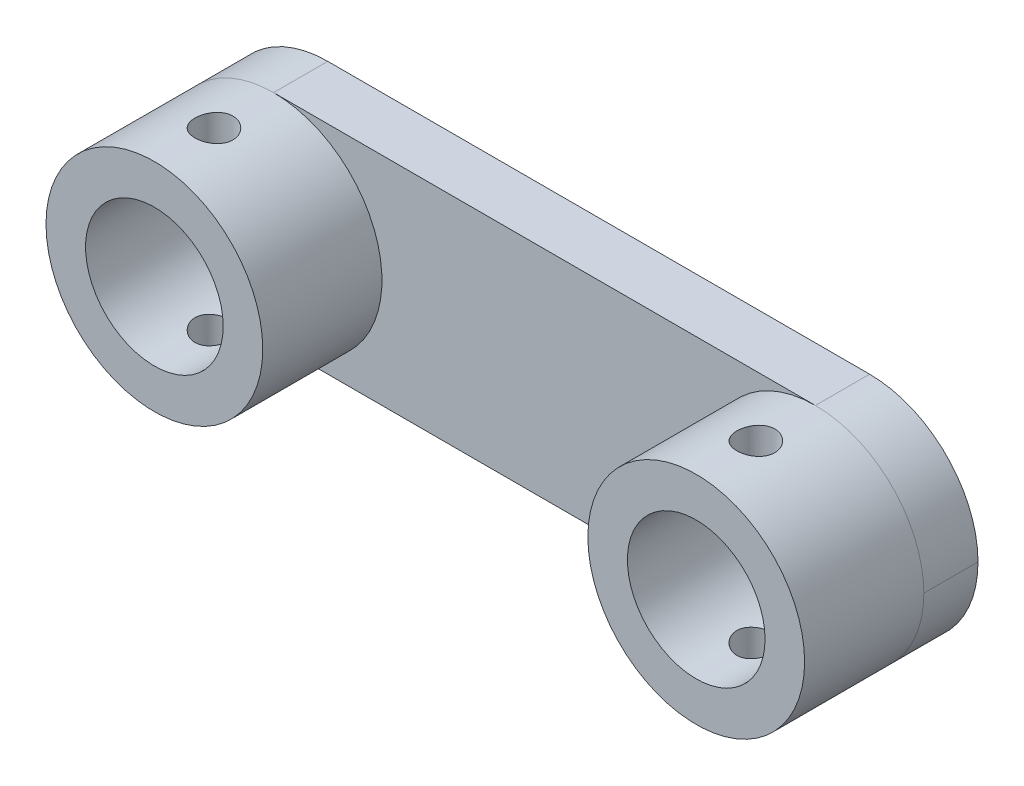
from build123d import *

# Parameters (mm, degrees)
SKETCH1_W           = 70
SKETCH1_H           = 20
BOSS_EXTRUDE1_DEPTH = 5
SKETCH2_R           = 10
SKETCH2_R_2         = 6.35
BOSS_EXTRUDE2_DEPTH = 11
SKETCH3_R           = 1.75
CUT_EXTRUDE1_DEPTH  = 44.370496884
FILLET1_R           = 10


with BuildPart() as part:
    # Sketch1 → Boss-Extrude1 (new body)
    with BuildSketch(Plane.XY):
        Rectangle(SKETCH1_W, SKETCH1_H)
    extrude(amount=BOSS_EXTRUDE1_DEPTH)

    # Sketch2 → Boss-Extrude2 (add)
    # profile 1 of 2: a face of its own
    with BuildSketch(Plane.XY.offset(5)):
        with Locations(Location((-25, 0, 0), (0, 0, 180))):
            Circle(SKETCH2_R)
        with Locations((-25, 0)):
            Circle(SKETCH2_R_2, mode=Mode.SUBTRACT)
    # profile 2 of 2: a face of its own
    with BuildSketch(Plane.XY.offset(5)):
        with Locations((25, 0)):
            Circle(SKETCH2_R)
        with Locations((25, 0)):
            Circle(SKETCH2_R_2, mode=Mode.SUBTRACT)
    extrude(amount=BOSS_EXTRUDE2_DEPTH)

    # Sketch3 → Cut-Extrude1 (cut, through all)
    with BuildSketch(Plane(origin=(0, 10, 0), x_dir=(1, 0, 0), z_dir=(0, 1, 0))):
        with Locations(Location((-25, -10.5, 0), (0, 0, 270))):
            Circle(SKETCH3_R)
        with Locations(Location((25, -10.5, 0), (0, 0, 270))):
            Circle(SKETCH3_R)
    extrude(amount=-CUT_EXTRUDE1_DEPTH, mode=Mode.SUBTRACT)

    # Fillet1
    fillet1_edges = [part.edges().sort_by_distance(p)[0] for p in [
        (-35, -10, 2.5),
        (-35, 10, 2.5),
        (35, 10, 2.5),
        (35, -10, 2.5),
    ]]
    fillet(fillet1_edges, radius=FILLET1_R - 0.0001)  # a hair under: the kernel refuses the full size


solid = part.part
